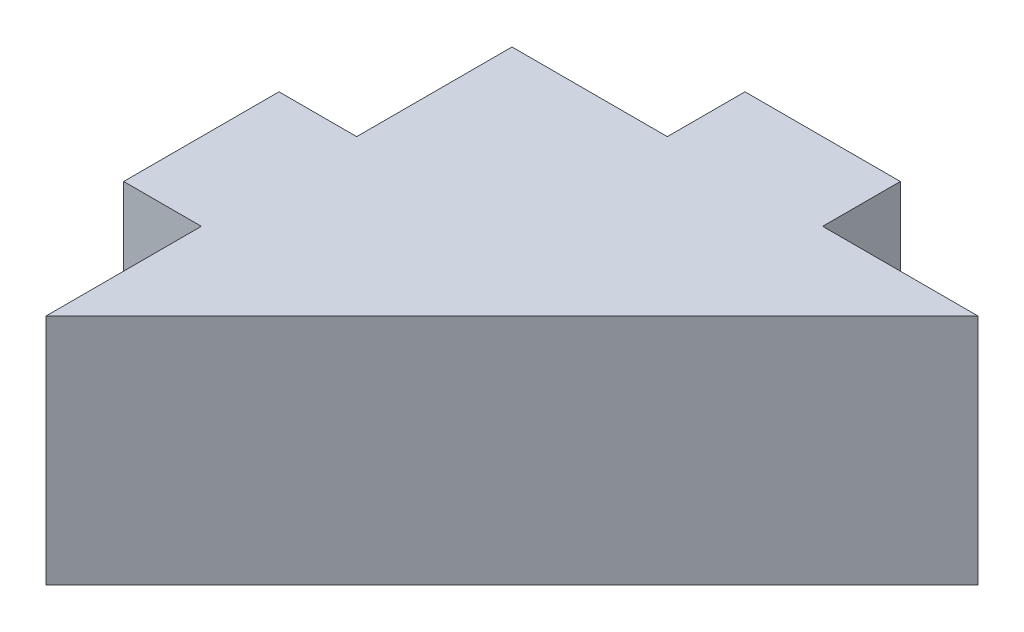
from build123d import *

# Parameters (mm, degrees)
ESQUISSE1_W        = 30
ESQUISSE1_H        = 30
BOSS_EXTRU_1_DEPTH = 15
ESQUISSE3_W        = 10
ESQUISSE3_H        = 15
BOSS_EXTRU_2_DEPTH = 5
CHANFREIN1_SIZE    = 30


with BuildPart() as part:
    # Esquisse1 → Boss.-Extru.1 (new body)
    with BuildSketch(Plane(origin=(0, 0, 0), x_dir=(1, 0, 0), z_dir=(0, 1, 0))):
        with Locations((15, -15)):
            Rectangle(ESQUISSE1_W, ESQUISSE1_H)
    extrude(amount=BOSS_EXTRU_1_DEPTH)

    # Esquisse3 → Boss.-Extru.2 (add)
    with BuildSketch(Plane(origin=(0, 0, 0), x_dir=(-1, 0, 0), z_dir=(0, 0, -1))):
        with Locations((-15, 7.5)):
            Rectangle(ESQUISSE3_W, ESQUISSE3_H)
    boss_extru_2 = extrude(amount=BOSS_EXTRU_2_DEPTH)

    # Symétrie1: Boss.-Extru.2 across plane
    add(boss_extru_2.mirror(Plane(origin=(0, 0, 0), x_dir=(0.7071067811865476, 0, 0.7071067811865475), z_dir=(0.7071067811865475, 0, -0.7071067811865476))))

    # Chanfrein1
    chanfrein1_edges = [part.edges().sort_by_distance(p)[0] for p in [
        (30, 7.5, 30),
    ]]
    chamfer(chanfrein1_edges, length=CHANFREIN1_SIZE - 0.0001)  # a hair under: the kernel refuses the full size


solid = part.part
